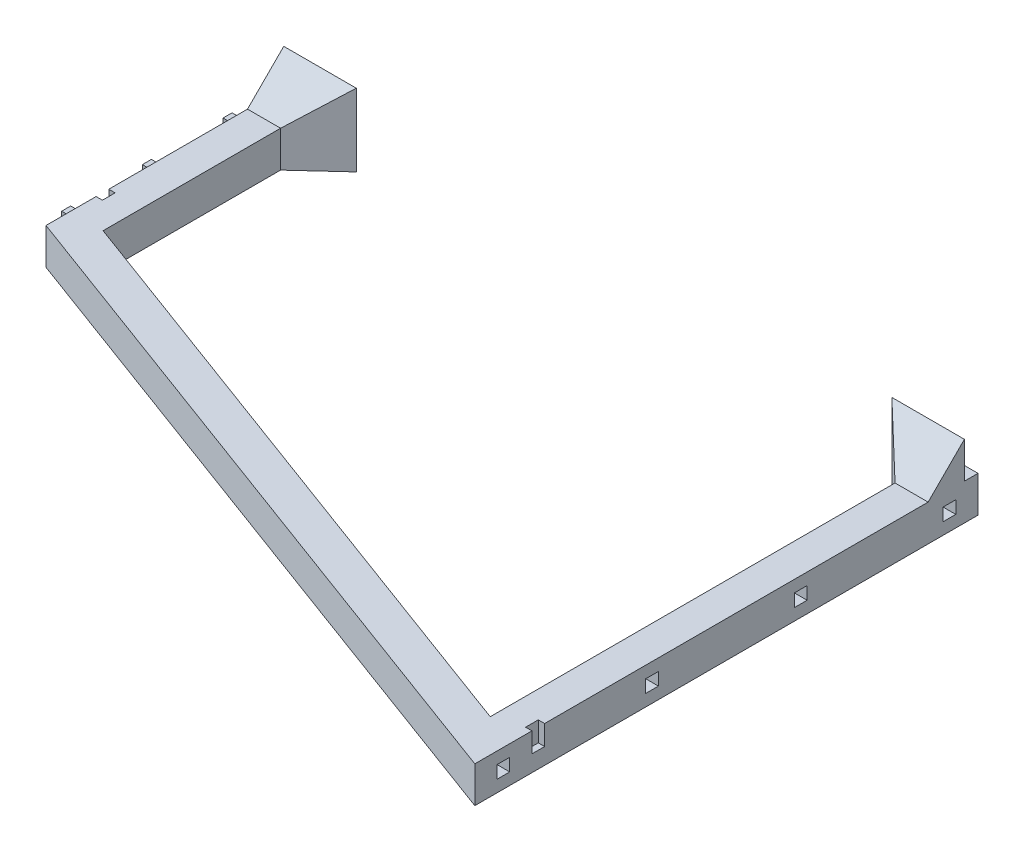
from build123d import *

# Parameters (mm, degrees)
P_IDAT_VYSUNUT_M1_DEPTH  = 8
SKICA3_W                 = 1.4
SKICA3_H                 = 2.8
ODEBRAT_VYSUNUT_M1_DEPTH = 4.4
P_IDAT_START             = 8
SKICA6_W                 = 16
SKICA6_H                 = 8
P_IDAT_VYSUNUT_M3_DEPTH  = 16
ODEBRAT_VYSUNUT_M3_DEPTH = 188.40870444
ODEBRAT_VYSUNUT_M4_DEPTH = 188.40870444
SKICA4_W                 = 2.8
SKICA4_H                 = 2.8
ODEBRAT_VYSUNUT_M2_DEPTH = 4.4
SKICA5_W                 = 2
SKICA5_H                 = 2
P_IDAT_VYSUNUT_M2_DEPTH  = 4
SKICA10_W                = 1.4
SKICA10_H                = 2.8
ODEBRAT_VYSUNUT_M5_DEPTH = 4.4


with BuildPart() as part:
    # Skica1 → Přidat vysunutím1 (new body)
    with BuildSketch(Plane(origin=(0, 0, 0), x_dir=(1, 0, 0), z_dir=(0, 1, 0))):
        Polygon((0, 0), (0, -111), (-150.15, -55.45), (-150.15, 0), (-142.85, 0), (-142.85, -50.153914462), (-7.3, -100.30244926), (-7.3, 0), align=None)
    extrude(amount=P_IDAT_VYSUNUT_M1_DEPTH)

    # Skica3 → Odebrat vysunutím1 (cut)
    with BuildSketch(Plane(origin=(0, 8, 0), x_dir=(1, 0, 0), z_dir=(0, 1, 0))):
        with Locations((-0.7, -97)):
            Rectangle(SKICA3_W, SKICA3_H)
    extrude(amount=-ODEBRAT_VYSUNUT_M1_DEPTH, mode=Mode.SUBTRACT)

    # Skica6 → Přidat vysunutím3 (add)
    with BuildSketch(Plane(origin=(0, 8, 0), x_dir=(1, 0, 0), z_dir=(0, 1, 0)).offset(P_IDAT_START)):
        with Locations((-142.15, -7)):
            Rectangle(SKICA6_W, SKICA6_H)
        with Locations((-8, -7)):
            Rectangle(SKICA6_W, SKICA6_H)
    extrude(amount=-P_IDAT_VYSUNUT_M3_DEPTH)

    # Skica8 → Odebrat vysunutím3 (cut, through all)
    with BuildSketch(Plane(origin=(0, 0, 0), x_dir=(0, 0, -1), z_dir=(1, 0, 0))):
        Polygon((-11, 8), (-11, 16), (-3, 16), align=None)
    extrude(amount=-ODEBRAT_VYSUNUT_M3_DEPTH, mode=Mode.SUBTRACT)

    # Skica9 → Odebrat vysunutím4 (cut, through all)
    with BuildSketch(Plane.XZ):
        Polygon((-142.85, 11), (-134.15, 11), (-134.15, 3), align=None)
        Polygon((-16, 11), (-7.3, 11), (-16, 3), align=None)
    extrude(amount=-ODEBRAT_VYSUNUT_M4_DEPTH, mode=Mode.SUBTRACT)

    # Skica4 → Odebrat vysunutím2 (cut)
    with BuildSketch(Plane(origin=(0, 0, 0), x_dir=(0, 0, -1), z_dir=(1, 0, 0))):
        with Locations((-104.7, 4)):
            Rectangle(SKICA4_W, SKICA4_H)
        with Locations((-71.9, 4)):
            Rectangle(SKICA4_W, SKICA4_H)
        with Locations((-39.1, 4)):
            Rectangle(SKICA4_W, SKICA4_H)
        with Locations((-6.3, 4)):
            Rectangle(SKICA4_W, SKICA4_H)
    extrude(amount=-ODEBRAT_VYSUNUT_M2_DEPTH, mode=Mode.SUBTRACT)

    # Skica5 → Přidat vysunutím2 (add)
    with BuildSketch(Plane.ZY.offset(150.15)):
        with Locations((11.4, 4)):
            Rectangle(SKICA5_W, SKICA5_H)
        with Locations((29.2, 4)):
            Rectangle(SKICA5_W, SKICA5_H)
        with Locations((47, 4)):
            Rectangle(SKICA5_W, SKICA5_H)
    extrude(amount=P_IDAT_VYSUNUT_M2_DEPTH)

    # Skica10 → Odebrat vysunutím5 (cut)
    with BuildSketch(Plane(origin=(0, 8, 0), x_dir=(1, 0, 0), z_dir=(0, 1, 0))):
        with Locations((-149.45, -43)):
            Rectangle(SKICA10_W, SKICA10_H)
    extrude(amount=-ODEBRAT_VYSUNUT_M5_DEPTH, mode=Mode.SUBTRACT)


solid = part.part
